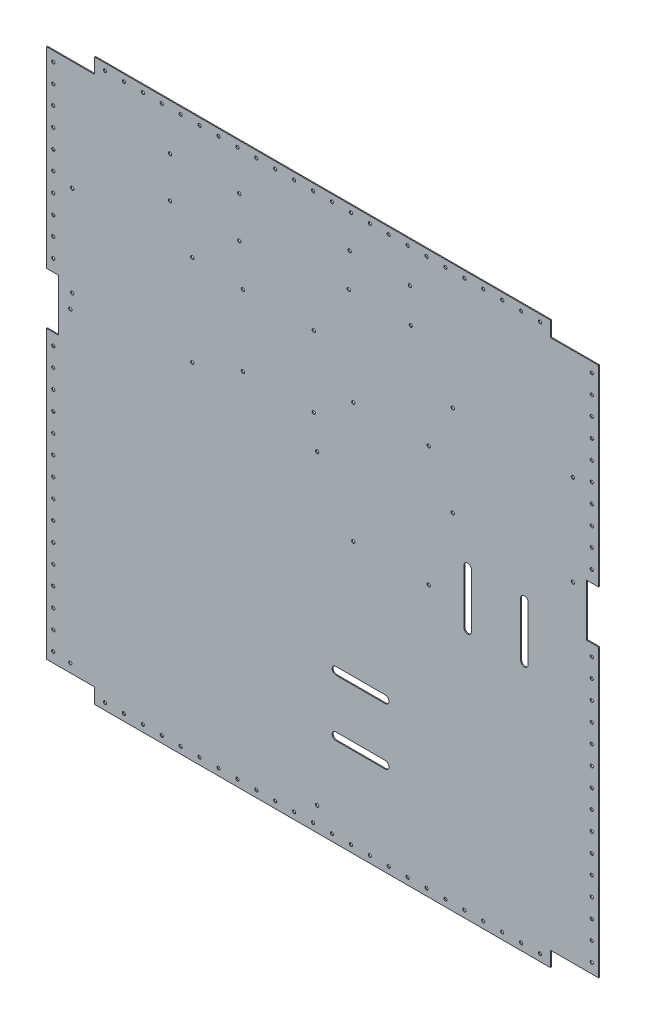
from build123d import *

# Parameters (mm, degrees)
BOSS_EXTRUDE1_DEPTH = 1.016
SKETCH2_R           = 1.675
CUT_EXTRUDE1_DEPTH  = 833.289632433
SKETCH8_R           = 1.75
CUT_EXTRUDE2_DEPTH  = 833.289632433
CUT_EXTRUDE3_DEPTH  = 833.289632433


with BuildPart() as part:
    # Sketch1 → Boss-Extrude1 (new body)
    with BuildSketch(Plane.XY):
        Polygon((0, 374), (0, 577), (51, 577), (51, 593), (533, 593), (533, 577), (584, 577), (584, 374), (571, 374), (571, 319), (584, 319), (584, 16), (533, 16), (533, 0), (51, 0), (51, 16), (0, 16), (0, 319), (13, 319), (13, 374), align=None)
    extrude(amount=BOSS_EXTRUDE1_DEPTH)

    # Sketch2 → Cut-Extrude1 (cut, through all)
    with BuildSketch(Plane.XY.offset(1.016)):
        with Locations((62, 585.825)):
            Circle(SKETCH2_R)
        with Locations((82, 585.825)):
            Circle(SKETCH2_R)
        with Locations((102, 585.825)):
            Circle(SKETCH2_R)
        with Locations((122, 585.825)):
            Circle(SKETCH2_R)
        with Locations((142, 585.825)):
            Circle(SKETCH2_R)
        with Locations((162, 585.825)):
            Circle(SKETCH2_R)
        with Locations((182, 585.825)):
            Circle(SKETCH2_R)
        with Locations((202, 585.825)):
            Circle(SKETCH2_R)
        with Locations((222, 585.825)):
            Circle(SKETCH2_R)
        with Locations((242, 585.825)):
            Circle(SKETCH2_R)
        with Locations((262, 585.825)):
            Circle(SKETCH2_R)
        with Locations((282, 585.825)):
            Circle(SKETCH2_R)
        with Locations((302, 585.825)):
            Circle(SKETCH2_R)
        with Locations((322, 585.825)):
            Circle(SKETCH2_R)
        with Locations((342, 585.825)):
            Circle(SKETCH2_R)
        with Locations((362, 585.825)):
            Circle(SKETCH2_R)
        with Locations((382, 585.825)):
            Circle(SKETCH2_R)
        with Locations((402, 585.825)):
            Circle(SKETCH2_R)
        with Locations((422, 585.825)):
            Circle(SKETCH2_R)
        with Locations((442, 585.825)):
            Circle(SKETCH2_R)
        with Locations((462, 585.825)):
            Circle(SKETCH2_R)
        with Locations((482, 585.825)):
            Circle(SKETCH2_R)
        with Locations((502, 585.825)):
            Circle(SKETCH2_R)
        with Locations((522, 585.825)):
            Circle(SKETCH2_R)
        with Locations((576.725, 566.5)):
            Circle(SKETCH2_R)
        with Locations((576.725, 546.5)):
            Circle(SKETCH2_R)
        with Locations((576.725, 526.5)):
            Circle(SKETCH2_R)
        with Locations((576.725, 506.5)):
            Circle(SKETCH2_R)
        with Locations((576.725, 486.5)):
            Circle(SKETCH2_R)
        with Locations((576.725, 466.5)):
            Circle(SKETCH2_R)
        with Locations((576.725, 446.5)):
            Circle(SKETCH2_R)
        with Locations((576.725, 426.5)):
            Circle(SKETCH2_R)
        with Locations((576.725, 406.5)):
            Circle(SKETCH2_R)
        with Locations((576.725, 386.5)):
            Circle(SKETCH2_R)
        with Locations((576.725, 306.5)):
            Circle(SKETCH2_R)
        with Locations((576.725, 286.5)):
            Circle(SKETCH2_R)
        with Locations((576.725, 266.5)):
            Circle(SKETCH2_R)
        with Locations((576.725, 246.5)):
            Circle(SKETCH2_R)
        with Locations((576.725, 226.5)):
            Circle(SKETCH2_R)
        with Locations((576.725, 206.5)):
            Circle(SKETCH2_R)
        with Locations((576.725, 186.5)):
            Circle(SKETCH2_R)
        with Locations((576.725, 166.5)):
            Circle(SKETCH2_R)
        with Locations((576.725, 146.5)):
            Circle(SKETCH2_R)
        with Locations((576.725, 126.5)):
            Circle(SKETCH2_R)
        with Locations((576.725, 106.5)):
            Circle(SKETCH2_R)
        with Locations((576.725, 86.5)):
            Circle(SKETCH2_R)
        with Locations((576.725, 66.5)):
            Circle(SKETCH2_R)
        with Locations((576.725, 46.5)):
            Circle(SKETCH2_R)
        with Locations((576.725, 26.5)):
            Circle(SKETCH2_R)
        with Locations((522, 7.175)):
            Circle(SKETCH2_R)
        with Locations((502, 7.175)):
            Circle(SKETCH2_R)
        with Locations((482, 7.175)):
            Circle(SKETCH2_R)
        with Locations((462, 7.175)):
            Circle(SKETCH2_R)
        with Locations((442, 7.175)):
            Circle(SKETCH2_R)
        with Locations((422, 7.175)):
            Circle(SKETCH2_R)
        with Locations((402, 7.175)):
            Circle(SKETCH2_R)
        with Locations((382, 7.175)):
            Circle(SKETCH2_R)
        with Locations((362, 7.175)):
            Circle(SKETCH2_R)
        with Locations((342, 7.175)):
            Circle(SKETCH2_R)
        with Locations((322, 7.175)):
            Circle(SKETCH2_R)
        with Locations((302, 7.175)):
            Circle(SKETCH2_R)
        with Locations((282, 7.175)):
            Circle(SKETCH2_R)
        with Locations((262, 7.175)):
            Circle(SKETCH2_R)
        with Locations((242, 7.175)):
            Circle(SKETCH2_R)
        with Locations((222, 7.175)):
            Circle(SKETCH2_R)
        with Locations((202, 7.175)):
            Circle(SKETCH2_R)
        with Locations((182, 7.175)):
            Circle(SKETCH2_R)
        with Locations((162, 7.175)):
            Circle(SKETCH2_R)
        with Locations((142, 7.175)):
            Circle(SKETCH2_R)
        with Locations((122, 7.175)):
            Circle(SKETCH2_R)
        with Locations((102, 7.175)):
            Circle(SKETCH2_R)
        with Locations((62, 7.175)):
            Circle(SKETCH2_R)
        with Locations((82, 7.175)):
            Circle(SKETCH2_R)
        with Locations((7.275, 26.5)):
            Circle(SKETCH2_R)
        with Locations((7.275, 46.5)):
            Circle(SKETCH2_R)
        with Locations((7.275, 66.5)):
            Circle(SKETCH2_R)
        with Locations((7.275, 86.5)):
            Circle(SKETCH2_R)
        with Locations((7.275, 106.5)):
            Circle(SKETCH2_R)
        with Locations((7.275, 126.5)):
            Circle(SKETCH2_R)
        with Locations((7.275, 146.5)):
            Circle(SKETCH2_R)
        with Locations((7.275, 166.5)):
            Circle(SKETCH2_R)
        with Locations((7.275, 186.5)):
            Circle(SKETCH2_R)
        with Locations((7.275, 206.5)):
            Circle(SKETCH2_R)
        with Locations((7.275, 226.5)):
            Circle(SKETCH2_R)
        with Locations((7.275, 246.5)):
            Circle(SKETCH2_R)
        with Locations((7.275, 266.5)):
            Circle(SKETCH2_R)
        with Locations((7.275, 286.5)):
            Circle(SKETCH2_R)
        with Locations((7.275, 306.5)):
            Circle(SKETCH2_R)
        with Locations((7.275, 386.5)):
            Circle(SKETCH2_R)
        with Locations((7.275, 406.5)):
            Circle(SKETCH2_R)
        with Locations((7.275, 426.5)):
            Circle(SKETCH2_R)
        with Locations((7.275, 446.5)):
            Circle(SKETCH2_R)
        with Locations((7.275, 466.5)):
            Circle(SKETCH2_R)
        with Locations((7.275, 486.5)):
            Circle(SKETCH2_R)
        with Locations((7.275, 506.5)):
            Circle(SKETCH2_R)
        with Locations((7.275, 526.5)):
            Circle(SKETCH2_R)
        with Locations((7.275, 546.5)):
            Circle(SKETCH2_R)
        with Locations((7.275, 566.5)):
            Circle(SKETCH2_R)
    extrude(amount=-CUT_EXTRUDE1_DEPTH, mode=Mode.SUBTRACT)

    # Sketch8 → Cut-Extrude2 (cut, through all)
    with BuildSketch(Plane.XY.offset(1.016)):
        with Locations((130.780438588, 544.221739262)):
            Circle(SKETCH8_R)
        with Locations((203.980438588, 544.221739262)):
            Circle(SKETCH8_R)
        with Locations((130.780438588, 501.021739262)):
            Circle(SKETCH8_R)
        with Locations((203.980438588, 501.021739262)):
            Circle(SKETCH8_R)
        with Locations((320.775, 550.325)):
            Circle(SKETCH8_R)
        with Locations((319.775, 514.325)):
            Circle(SKETCH8_R)
        with Locations((385.375, 514.325)):
            Circle(SKETCH8_R)
        with Locations((384.375, 550.325)):
            Circle(SKETCH8_R)
        with Locations((429.725, 460.825)):
            Circle(SKETCH8_R)
        with Locations((556.725, 460.825)):
            Circle(SKETCH8_R)
        with Locations((556.725, 364.825)):
            Circle(SKETCH8_R)
        with Locations((429.725, 364.825)):
            Circle(SKETCH8_R)
        with Locations((324.55, 413.325)):
            Circle(SKETCH8_R)
        with Locations((404.225, 413.325)):
            Circle(SKETCH8_R)
        with Locations((324.55, 286.025)):
            Circle(SKETCH8_R)
        with Locations((404.225, 286.025)):
            Circle(SKETCH8_R)
        with Locations((286.275, 25.175)):
            Circle(SKETCH8_R)
        with Locations((25.275, 25.175)):
            Circle(SKETCH8_R)
        with Locations((25.275, 349.175)):
            Circle(SKETCH8_R)
        with Locations((286.275, 349.175)):
            Circle(SKETCH8_R)
        with Locations((154.275, 460.825)):
            Circle(SKETCH8_R)
        with Locations((27.275, 460.825)):
            Circle(SKETCH8_R)
        with Locations((27.275, 364.825)):
            Circle(SKETCH8_R)
        with Locations((154.275, 364.825)):
            Circle(SKETCH8_R)
        with Locations((207.775, 458.325)):
            Circle(SKETCH8_R)
        with Locations((207.775, 383.325)):
            Circle(SKETCH8_R)
        with Locations((282.775, 458.325)):
            Circle(SKETCH8_R)
        with Locations((282.775, 383.325)):
            Circle(SKETCH8_R)
    extrude(amount=-CUT_EXTRUDE2_DEPTH, mode=Mode.SUBTRACT)

    # Sketch9 → Cut-Extrude3 (cut, through all)
    with BuildSketch(Plane.XY.offset(1.016)):
        with BuildLine():
            Line((501.475, 265.675), (501.475, 322.675))
            ThreePointArc((501.475, 322.675), (505.475, 326.675), (509.475, 322.675))
            Line((509.475, 322.675), (509.475, 265.675))
            ThreePointArc((509.475, 265.675), (505.475, 261.675), (501.475, 265.675))
        make_face()
        with BuildLine():
            Line((441.475, 265.675), (441.475, 322.675))
            ThreePointArc((441.475, 322.675), (445.475, 326.675), (449.475, 322.675))
            Line((449.475, 322.675), (449.475, 265.675))
            ThreePointArc((449.475, 265.675), (445.475, 261.675), (441.475, 265.675))
        make_face()
        with BuildLine():
            Line((358.225, 154.425), (306.225, 154.425))
            ThreePointArc((306.225, 154.425), (302.225, 158.425), (306.225, 162.425))
            Line((306.225, 162.425), (358.225, 162.425))
            ThreePointArc((358.225, 162.425), (362.225, 158.425), (358.225, 154.425))
        make_face()
        with BuildLine():
            Line((306.225, 102.425), (358.225, 102.425))
            ThreePointArc((358.225, 102.425), (362.225, 98.425), (358.225, 94.425))
            Line((358.225, 94.425), (306.225, 94.425))
            ThreePointArc((306.225, 94.425), (302.225, 98.425), (306.225, 102.425))
        make_face()
    extrude(amount=-CUT_EXTRUDE3_DEPTH, mode=Mode.SUBTRACT)


solid = part.part
